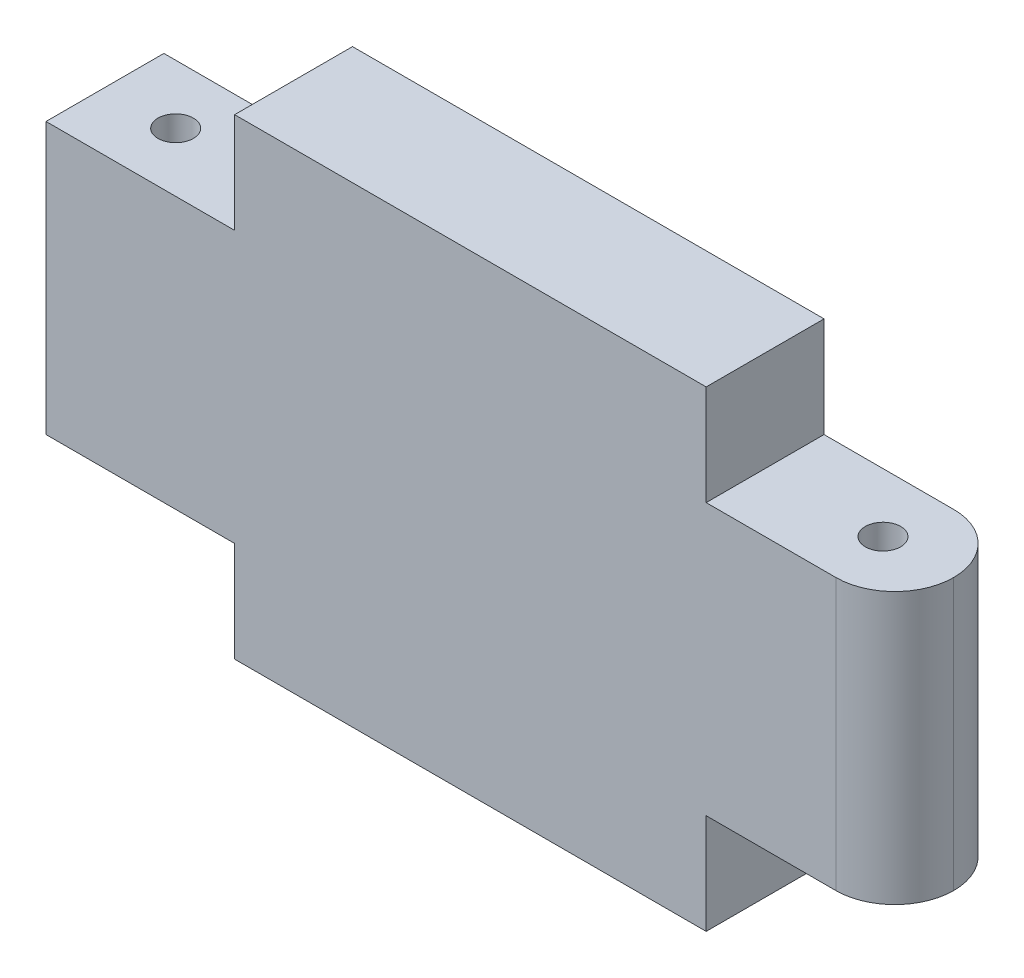
from build123d import *

# Parameters (mm, degrees)
SKETCH_1_W          = 40
SKETCH_1_H          = 40
EXTRUDE_1_DEPTH     = 10
SKETCH_2_W          = 10
SKETCH_2_H          = 23
EXTRUDE_2_DEPTH     = 16
SKETCH_3_R          = 1.5
CUT_EXTRUDE_1_DEPTH = 30
FILLET_2_R          = 5


with BuildPart() as part:
    # 草图1 → 凸台-拉伸1 (new body)
    with BuildSketch(Plane.XY):
        Rectangle(SKETCH_1_W, SKETCH_1_H)
    extrude(amount=EXTRUDE_1_DEPTH)

    # 草图2 → 凸台-拉伸2 (add)
    with BuildSketch(Plane.ZY.offset(20)):
        with Locations((5, 0)):
            Rectangle(SKETCH_2_W, SKETCH_2_H)
    extrude_2 = extrude(amount=EXTRUDE_2_DEPTH)

    # 草图3 → 切除-拉伸1 (cut)
    with BuildSketch(Plane(origin=(0, 11.5, 0), x_dir=(1, 0, 0), z_dir=(0, 1, 0))):
        with Locations(Location((-30, -5, 0), (0, 0, 180))):
            Circle(SKETCH_3_R)
    cut_extrude_1 = extrude(amount=-CUT_EXTRUDE_1_DEPTH, mode=Mode.SUBTRACT)

    # 镜向1: 凸台-拉伸2, 切除-拉伸1 across plane
    add(extrude_2.mirror(Plane(origin=(0, 0, 0), x_dir=(0, 0, 1), z_dir=(1, 0, 0))))
    add(cut_extrude_1.mirror(Plane(origin=(0, 0, 0), x_dir=(0, 0, 1), z_dir=(1, 0, 0))), mode=Mode.SUBTRACT)

    # 圆角2
    fillet_2_edges = [part.edges().sort_by_distance(p)[0] for p in [
        (36, 0, 0),
        (36, 0, 10),
    ]]
    fillet(fillet_2_edges, radius=FILLET_2_R - 0.0001)  # a hair under: the kernel refuses the full size


solid = part.part
